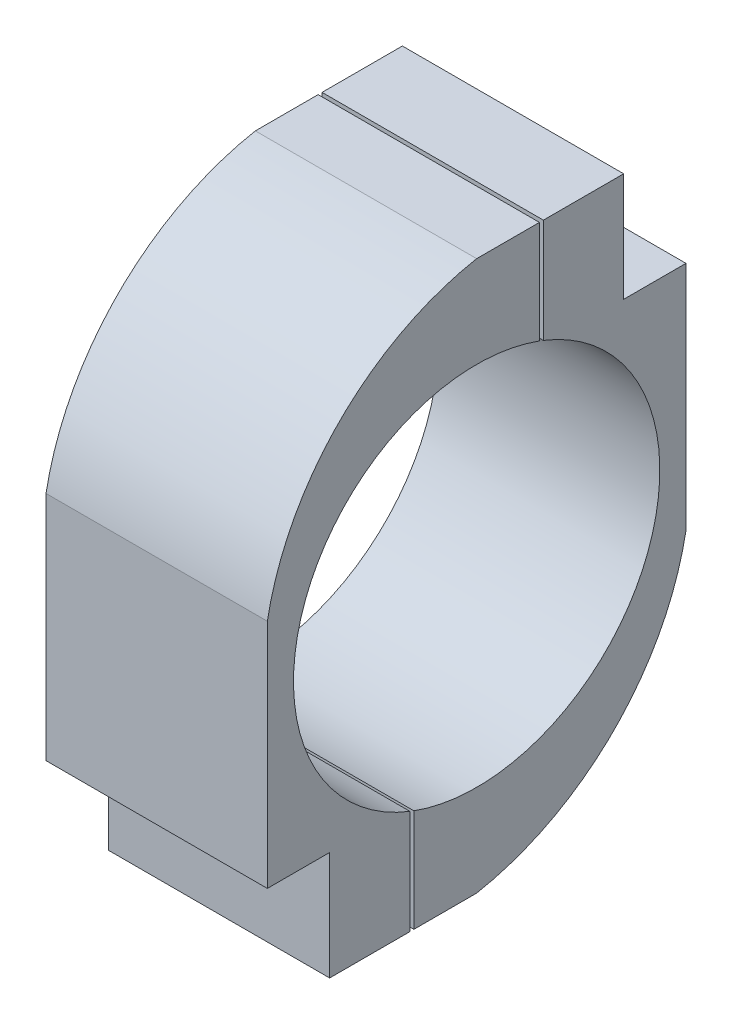
from build123d import *

# Parameters (mm, degrees)
BOSS_EXTRUDE1_DEPTH = 8.4582
BOSS_EXTRUDE2_DEPTH = 8.4582


with BuildPart() as part:
    # Sketch2 → Boss-Extrude1 (new, symmetric)
    with BuildSketch(Plane(origin=(0, 0, 0), x_dir=(0, 0, -1), z_dir=(1, 0, 0))):
        with BuildLine():
            Line((11.2375, 12.626420089), (11.2375, 20.926598663))
            Line((11.2375, 20.926598663), (5.1, 20.926598663))
            Line((5.1, 20.926598663), (5.1, 12.964619985))
            ThreePointArc((5.1, 12.964619985), (13.757403434, -2.668367762), (0, -14.073401337))
            ThreePointArc((0, -14.073401337), (-2.437215533, -13.859625637), (-4.8, -13.224827115))
            Line((-4.8, -13.224827115), (-4.8, -21.073401337))
            Line((-4.8, -21.073401337), (0, -21.073401337))
            ThreePointArc((0, -21.073401337), (10.480231834, -15.553633171), (16, -5.073401337))
            Line((16, -5.073401337), (16, 12.616598663))
            Line((16, 12.616598663), (11.2375, 12.616598663))
            Line((11.2375, 12.616598663), (11.2375, 12.626420089))
        make_face()
    extrude(amount=BOSS_EXTRUDE1_DEPTH, both=True)


with BuildPart() as body_2:
    # Sketch2<4> → Boss-Extrude2 (new, symmetric)
    with BuildSketch(Plane(origin=(0, 0, 0), x_dir=(0, 0, -1), z_dir=(1, 0, 0))):
        with BuildLine():
            Line((-11.2375, -12.773222763), (-11.2375, -21.073401337))
            Line((-11.2375, -21.073401337), (-5.1, -21.073401337))
            Line((-5.1, -21.073401337), (-5.1, -13.111422659))
            ThreePointArc((-5.1, -13.111422659), (-13.757403434, 2.521565087), (0, 13.926598663))
            ThreePointArc((0, 13.926598663), (2.437215533, 13.712822963), (4.8, 13.078024441))
            Line((4.8, 13.078024441), (4.8, 20.926598663))
            Line((4.8, 20.926598663), (0, 20.926598663))
            ThreePointArc((0, 20.926598663), (-10.480231834, 15.406830497), (-16, 4.926598663))
            Line((-16, 4.926598663), (-16, -12.763401337))
            Line((-16, -12.763401337), (-11.2375, -12.763401337))
            Line((-11.2375, -12.763401337), (-11.2375, -12.773222763))
        make_face()
    extrude(amount=BOSS_EXTRUDE2_DEPTH, both=True)


solid = Compound([part.part, body_2.part])
